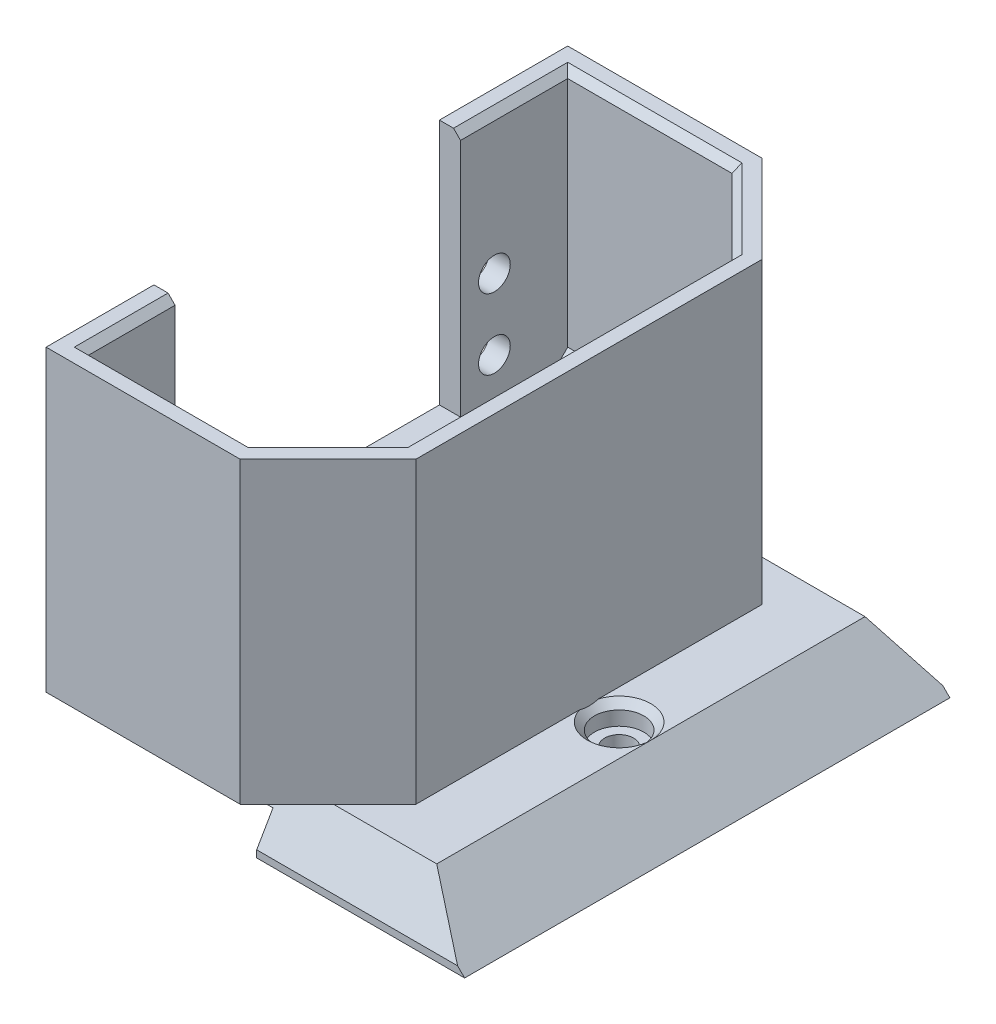
from build123d import *

# Parameters (mm, degrees)
MAIN_FACE_EXTRUDE_DEPTH              = 7.4
MAIN_WALLS_EXTRUDE_DEPTH             = 35
MAIN_WALLS_LOWER_CHAMFER_SIZE        = 1
MAIN_WALLS_ENTRY_CHAMFER_SIZE        = 1
SKETCH4_W                            = 3
SKETCH4_H                            = 40.5
SERVO_MOUNT_CUT_DEPTH                = 35
SERVO_MOUNT_HOLES_REACH              = 72.134
SKETCH5_R                            = 2.25
MOUNT_DOVETAIL_DEPTH                 = 56.8
MOUNT_DOVETAIL_CHAMFER_SIZE          = 8
SKETCH9_W                            = 27.3
SKETCH9_H                            = 68.845299462
DOVETAIL_OFFSET_CUT_DEPTH            = 5
SKETCH10_R                           = 2.05
MOUNT_SCREW_HOLE_DEPTH               = 69.359344643
SKETCH11_R                           = 3.5
MOUNT_SCREW_COUNTERSINK_DEPTH        = 3
MOUNT_SCREW_COUNTERSINK_CHAMFER_SIZE = 1
GEAR_CUT_DEPTH                       = 65.033116432
GEAR_ENTRY_CHAMFER_SIZE              = 3


# Some blends are built 0.0001 mm under size
with BuildPart() as part:
    # Sketch1 → Main Face Extrude (new body)
    with BuildSketch(Plane(origin=(0, 0, 0), x_dir=(1, 0, 0), z_dir=(0, 1, 0))):
        Polygon((-20, 35), (7.542640687, 35), (20, 22.542640687), (20, -26.542640687), (7.542640687, -39), (-20, -39), align=None)
    extrude(amount=MAIN_FACE_EXTRUDE_DEPTH)

    # Sketch3 → Main Walls Extrude (add)
    with BuildSketch(Plane(origin=(0, 7.4, 0), x_dir=(1, 0, 0), z_dir=(0, 1, 0))):
        Polygon((-20, 35), (-20, -39), (7.542640687, -39), (20, -26.542640687), (20, 22.542640687), (7.542640687, 35), align=None)
        Polygon((-17, 32), (-17, -36), (6.3, -36), (17, -25.3), (17, 21.3), (6.3, 32), align=None, mode=Mode.SUBTRACT)
    extrude(amount=MAIN_WALLS_EXTRUDE_DEPTH)

    # Main Walls Lower Chamfer
    main_walls_lower_chamfer_edges = [part.edges().sort_by_distance(p)[0] for p in [
        (-5.35, 7.4, -32),
        (-5.35, 7.4, 36),
        (11.65, 7.4, 30.65),
        (17, 7.4, 2),
        (11.65, 7.4, -26.65),
    ]]
    chamfer(main_walls_lower_chamfer_edges, length=MAIN_WALLS_LOWER_CHAMFER_SIZE)

    # Main Walls Entry Chamfer
    main_walls_entry_chamfer_edges = [part.edges().sort_by_distance(p)[0] for p in [
        (-5.35, 42.4, -32),
        (-17, 42.4, 2),
        (-5.35, 42.4, 36),
        (11.65, 42.4, 30.65),
        (17, 42.4, 2),
        (11.65, 42.4, -26.65),
    ]]
    chamfer(main_walls_entry_chamfer_edges, length=MAIN_WALLS_ENTRY_CHAMFER_SIZE)

    # Sketch4 → Servo Mount Cut (cut)
    with BuildSketch(Plane(origin=(0, 42.4, 0), x_dir=(1, 0, 0), z_dir=(0, 1, 0))):
        with Locations((-18.5, -3.45)):
            Rectangle(SKETCH4_W, SKETCH4_H)
    extrude(amount=-SERVO_MOUNT_CUT_DEPTH, mode=Mode.SUBTRACT)

    # Sketch5 → Servo Mount Holes (cut, up to next)
    with BuildSketch(Plane.ZY.offset(20), mode=Mode.PRIVATE) as servo_mount_holes_sk1:
        with Locations((-21.6, 22.65)):
            Circle(SKETCH5_R)
    servo_mount_holes_tool1 = extrude(servo_mount_holes_sk1.sketch, amount=-SERVO_MOUNT_HOLES_REACH, mode=Mode.PRIVATE) & part.part
    # Sketch5 → Servo Mount Holes (cut, up to next)
    with BuildSketch(Plane.ZY.offset(20), mode=Mode.PRIVATE) as servo_mount_holes_sk2:
        with Locations((-21.6, 12.65)):
            Circle(SKETCH5_R)
    servo_mount_holes_tool2 = extrude(servo_mount_holes_sk2.sketch, amount=-SERVO_MOUNT_HOLES_REACH, mode=Mode.PRIVATE) & part.part
    # Sketch5 → Servo Mount Holes (cut, up to next)
    with BuildSketch(Plane.ZY.offset(20), mode=Mode.PRIVATE) as servo_mount_holes_sk3:
        with Locations((28.5, 22.65)):
            Circle(SKETCH5_R)
    servo_mount_holes_tool3 = extrude(servo_mount_holes_sk3.sketch, amount=-SERVO_MOUNT_HOLES_REACH, mode=Mode.PRIVATE) & part.part
    # Sketch5 → Servo Mount Holes (cut, up to next)
    with BuildSketch(Plane.ZY.offset(20), mode=Mode.PRIVATE) as servo_mount_holes_sk4:
        with Locations((28.5, 12.65)):
            Circle(SKETCH5_R)
    servo_mount_holes_tool4 = extrude(servo_mount_holes_sk4.sketch, amount=-SERVO_MOUNT_HOLES_REACH, mode=Mode.PRIVATE) & part.part
    add(servo_mount_holes_tool1.solids().sort_by_distance((-20, 22.65, -21.6))[0], mode=Mode.SUBTRACT)
    add(servo_mount_holes_tool2.solids().sort_by_distance((-20, 12.65, -21.6))[0], mode=Mode.SUBTRACT)
    add(servo_mount_holes_tool3.solids().sort_by_distance((-20, 22.65, 28.5))[0], mode=Mode.SUBTRACT)
    add(servo_mount_holes_tool4.solids().sort_by_distance((-20, 12.65, 28.5))[0], mode=Mode.SUBTRACT)

    # Sketch8 → Mount Dovetail (add)
    with BuildSketch(Plane.ZY.offset(20)):
        Polygon((-28.381197846, 0), (-32.422649731, -7), (-32.422649731, -8), (36.422649731, -8), (36.422649731, -7), (32.381197846, 0), align=None)
    extrude(amount=-MOUNT_DOVETAIL_DEPTH)

    # Mount Dovetail Chamfer
    mount_dovetail_chamfer_edges = [part.edges().sort_by_distance(p)[0] for p in [
        (36.8, 0, 2),
    ]]
    chamfer(mount_dovetail_chamfer_edges, length=MOUNT_DOVETAIL_CHAMFER_SIZE - 0.0001)  # a hair under: the kernel refuses the full size

    # Sketch9 → Dovetail Offset Cut (cut)
    with BuildSketch(Plane.XZ.offset(8)):
        with Locations((-6.35, 2)):
            Rectangle(SKETCH9_W, SKETCH9_H)
    extrude(amount=-DOVETAIL_OFFSET_CUT_DEPTH, mode=Mode.SUBTRACT)

    # Sketch10 → Mount Screw Hole (cut, through all)
    with BuildSketch(Plane(origin=(0, 0, 0), x_dir=(1, 0, 0), z_dir=(0, 1, 0))):
        with Locations(Location((24.3, -2, 0), (0, 0, 270))):
            Circle(SKETCH10_R)
    extrude(amount=-MOUNT_SCREW_HOLE_DEPTH, mode=Mode.SUBTRACT)

    # Sketch11 → Mount Screw Countersink (cut)
    with BuildSketch(Plane(origin=(0, 0, 0), x_dir=(1, 0, 0), z_dir=(0, 1, 0))):
        with Locations(Location((24.3, -2, 0), (0, 0, 270))):
            Circle(SKETCH11_R)
    extrude(amount=-MOUNT_SCREW_COUNTERSINK_DEPTH, mode=Mode.SUBTRACT)

    # Mount Screw Countersink Chamfer
    # the kernel refuses this chamfer: 1 mm, written as the material it takes off along each edge
    with BuildSketch(Plane(origin=(24.3, 0, 2), x_dir=(0, 0, 1), z_dir=(-1, 0, 0))) as mount_screw_countersink_chamfer_piece_1_section:
        Polygon((3.5 + MOUNT_SCREW_COUNTERSINK_CHAMFER_SIZE, 0), (3.5, -MOUNT_SCREW_COUNTERSINK_CHAMFER_SIZE), (3.5, 0), align=None)
    mount_screw_countersink_chamfer_piece_1 = revolve(axis=Axis((24.3, 0, 2), (0, 1, 0)), mode=Mode.PRIVATE)
    mount_screw_countersink_chamfer_piece_1 = split(mount_screw_countersink_chamfer_piece_1, bisect_by=Plane(origin=(20, -0.483290811, -1.983290811), z_dir=(1, 0, 0)), keep=Keep.TOP, mode=Mode.PRIVATE)
    add(mount_screw_countersink_chamfer_piece_1, mode=Mode.SUBTRACT)

    # Sketch2 → Gear Cut (cut, through all)
    with BuildSketch(Plane(origin=(0, 7.4, 0), x_dir=(1, 0, 0), z_dir=(0, 1, 0))):
        Polygon((-1.7, 26.5), (5.3, 26.5), (7.3, 24.5), (7.3, -11.5), (5.3, -13.5), (-1.7, -13.5), (-3.7, -11.5), (-3.7, 24.5), align=None)
    extrude(amount=-GEAR_CUT_DEPTH, mode=Mode.SUBTRACT)

    # Gear Entry Chamfer
    gear_entry_chamfer_edges = [part.edges().sort_by_distance(p)[0] for p in [
        (-2.7, 7.4, -25.5),
        (-3.7, 7.4, -6.5),
        (-2.7, 7.4, 12.5),
        (1.8, 7.4, 13.5),
        (6.3, 7.4, 12.5),
        (7.3, 7.4, -6.5),
        (6.3, 7.4, -25.5),
        (1.8, 7.4, -26.5),
    ]]
    chamfer(gear_entry_chamfer_edges, length=GEAR_ENTRY_CHAMFER_SIZE)


solid = part.part
